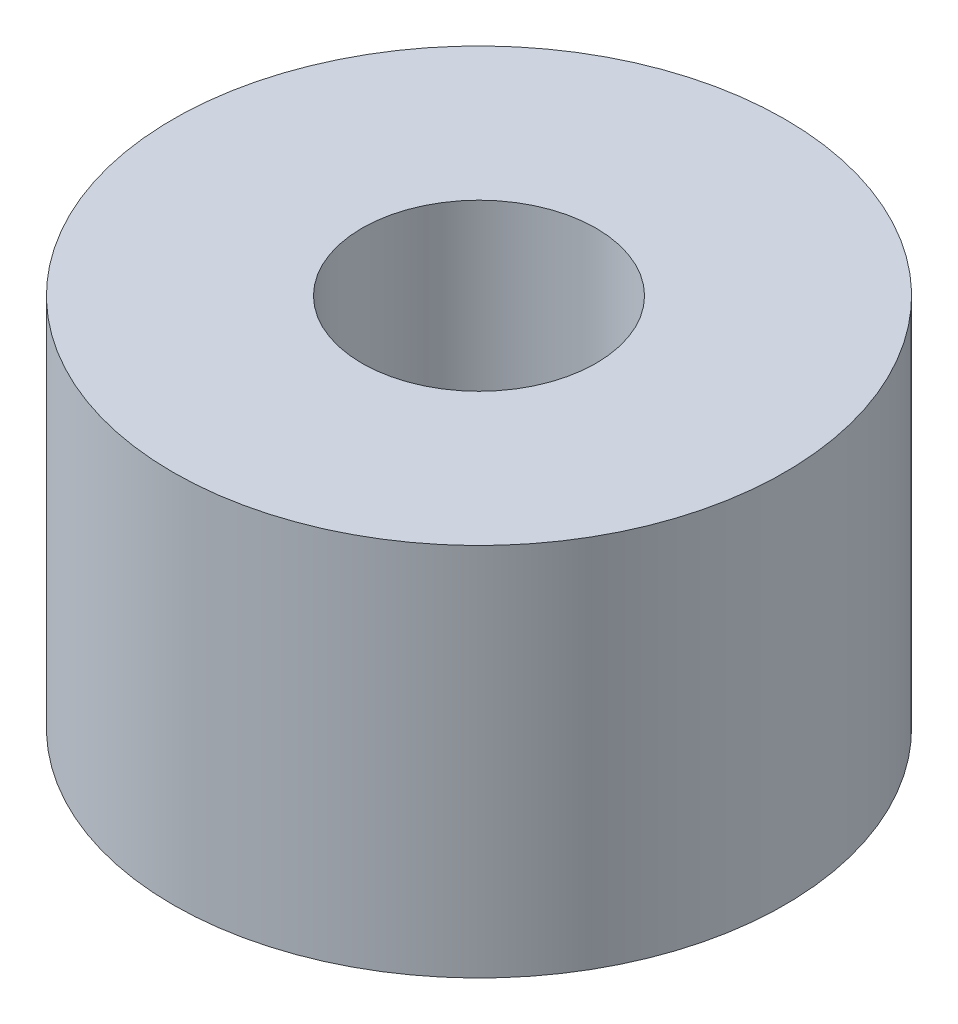
from build123d import *

# Parameters (mm, degrees)
SKETCH1_R           = 12.446
SKETCH1_R_2         = 4.7625
BOSS_EXTRUDE1_DEPTH = 15.24


with BuildPart() as part:
    # Sketch1 → Boss-Extrude1 (new body)
    with BuildSketch(Plane(origin=(0, 0, 0), x_dir=(1, 0, 0), z_dir=(0, 1, 0))):
        Circle(SKETCH1_R)
        Circle(SKETCH1_R_2, mode=Mode.SUBTRACT)
    extrude(amount=BOSS_EXTRUDE1_DEPTH)


solid = part.part
